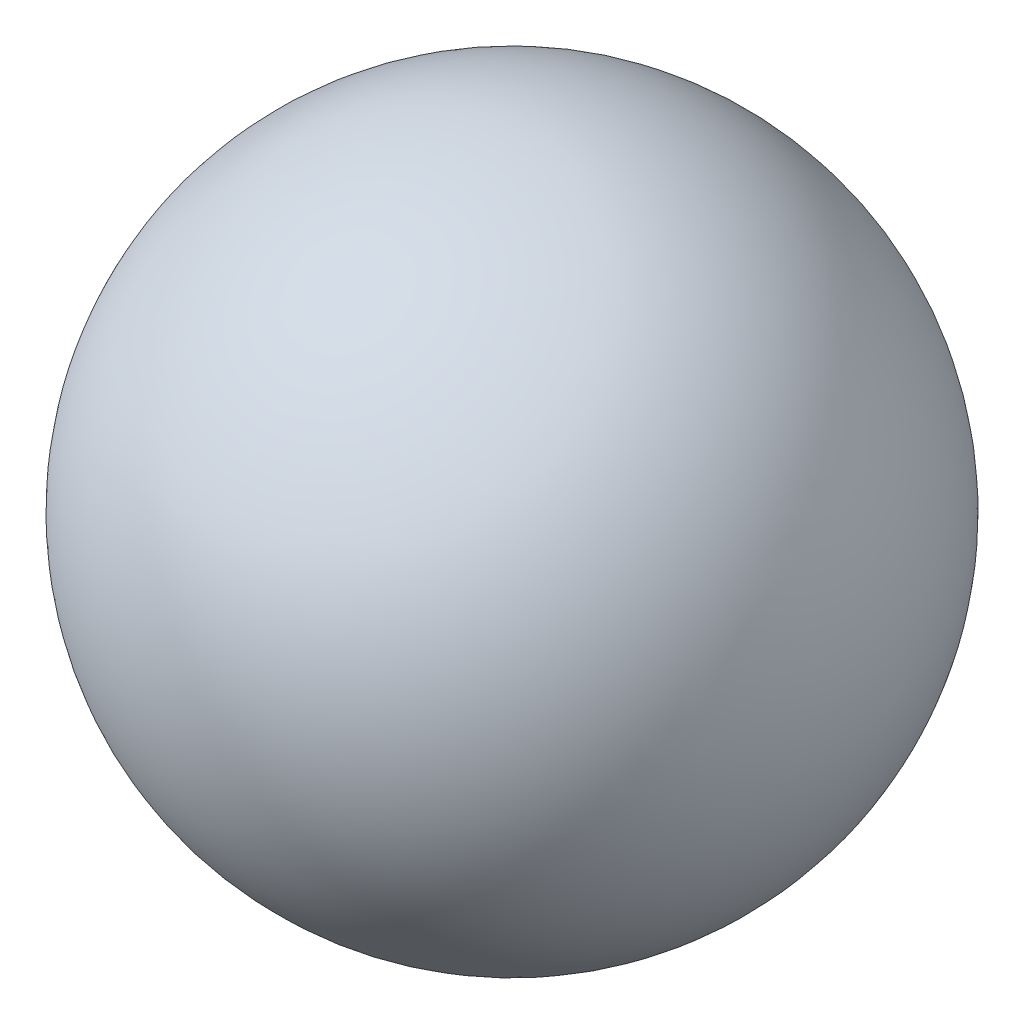
from build123d import *


with BuildPart() as part:
    # Sketch1 → Revolve1 (revolve)
    with BuildSketch(Plane(origin=(0, 0, 0), x_dir=(1, 0, 0), z_dir=(0, 1, 0))):
        with BuildLine():
            ThreePointArc((1.75, 0), (0, 1.75), (-1.75, 0))
            Line((-1.75, 0), (1.75, 0))
        make_face()
    revolve(axis=Axis((-1.75, 0, 0), (1, 0, 0)))


solid = part.part
